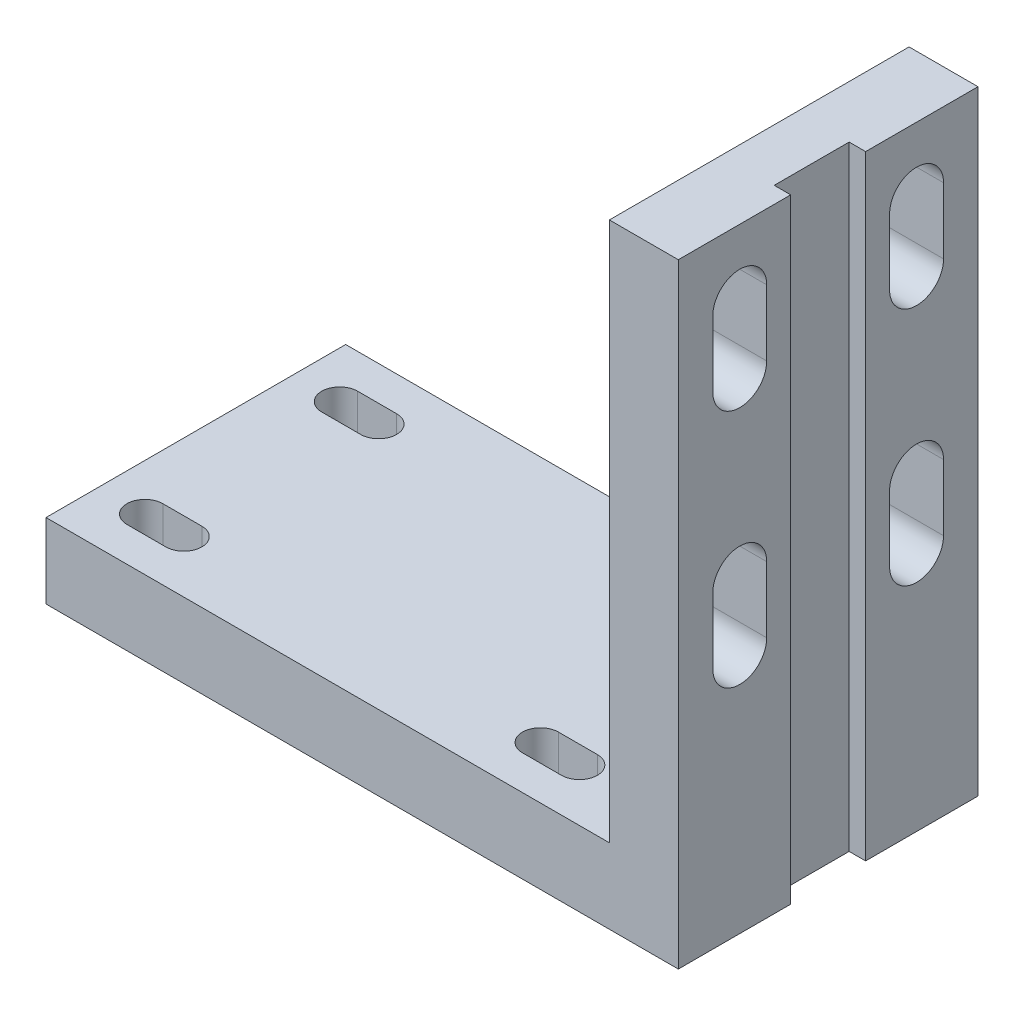
from build123d import *

# Parameters (mm, degrees)
SKETCH_1_W          = 23
SKETCH_1_H          = 205
EXTRUDE_1_DEPTH     = 100
SKETCH_3_W          = 188
SKETCH_3_H          = 25
EXTRUDE_3_DEPTH     = 100
CUT_EXTRUDE_1_REACH = 312.719
CUT_EXTRUDE_2_REACH = 312.719
SKETCH_6_W          = 25
SKETCH_6_H          = 205
CUT_EXTRUDE_3_DEPTH = 5.5


with BuildPart() as part:
    # 草图1 → 凸台-拉伸1 (new body)
    with BuildSketch(Plane.XY):
        with Locations((-11.5, -102.5)):
            Rectangle(SKETCH_1_W, SKETCH_1_H)
    extrude(amount=EXTRUDE_1_DEPTH)

    # 草图3 → 凸台-拉伸3 (add)
    with BuildSketch(Plane.XY.offset(100)):
        with Locations((-117, -192.5)):
            Rectangle(SKETCH_3_W, SKETCH_3_H)
    extrude(amount=-EXTRUDE_3_DEPTH)

    # 草图4 → 切除-拉伸1 (cut, up to next)
    with BuildSketch(Plane(origin=(0, 0, 0), x_dir=(0, 0, -1), z_dir=(1, 0, 0)), mode=Mode.PRIVATE) as cut_extrude_1_sk1:
        with BuildLine():
            Line((-70.5, -22), (-70.5, -44))
            ThreePointArc((-70.5, -44), (-79.5, -53), (-88.5, -44))
            Line((-88.5, -44), (-88.5, -22))
            ThreePointArc((-88.5, -22), (-79.5, -13), (-70.5, -22))
        make_face()
    cut_extrude_1_tool1 = extrude(cut_extrude_1_sk1.sketch, amount=-CUT_EXTRUDE_1_REACH, mode=Mode.PRIVATE) & part.part
    # 草图4 → 切除-拉伸1 (cut, up to next)
    with BuildSketch(Plane(origin=(0, 0, 0), x_dir=(0, 0, -1), z_dir=(1, 0, 0)), mode=Mode.PRIVATE) as cut_extrude_1_sk2:
        with BuildLine():
            Line((-11.5, -22), (-11.5, -44))
            ThreePointArc((-11.5, -44), (-20.5, -53), (-29.5, -44))
            Line((-29.5, -44), (-29.5, -22))
            ThreePointArc((-29.5, -22), (-20.5, -13), (-11.5, -22))
        make_face()
    cut_extrude_1_tool2 = extrude(cut_extrude_1_sk2.sketch, amount=-CUT_EXTRUDE_1_REACH, mode=Mode.PRIVATE) & part.part
    # 草图4 → 切除-拉伸1 (cut, up to next)
    with BuildSketch(Plane(origin=(0, 0, 0), x_dir=(0, 0, -1), z_dir=(1, 0, 0)), mode=Mode.PRIVATE) as cut_extrude_1_sk3:
        with BuildLine():
            Line((-70.5, -102), (-70.5, -124))
            ThreePointArc((-70.5, -124), (-79.5, -133), (-88.5, -124))
            Line((-88.5, -124), (-88.5, -102))
            ThreePointArc((-88.5, -102), (-79.5, -93), (-70.5, -102))
        make_face()
    cut_extrude_1_tool3 = extrude(cut_extrude_1_sk3.sketch, amount=-CUT_EXTRUDE_1_REACH, mode=Mode.PRIVATE) & part.part
    # 草图4 → 切除-拉伸1 (cut, up to next)
    with BuildSketch(Plane(origin=(0, 0, 0), x_dir=(0, 0, -1), z_dir=(1, 0, 0)), mode=Mode.PRIVATE) as cut_extrude_1_sk4:
        with BuildLine():
            Line((-11.5, -102), (-11.5, -124))
            ThreePointArc((-11.5, -124), (-20.5, -133), (-29.5, -124))
            Line((-29.5, -124), (-29.5, -102))
            ThreePointArc((-29.5, -102), (-20.5, -93), (-11.5, -102))
        make_face()
    cut_extrude_1_tool4 = extrude(cut_extrude_1_sk4.sketch, amount=-CUT_EXTRUDE_1_REACH, mode=Mode.PRIVATE) & part.part
    add(cut_extrude_1_tool1.solids().sort_by_distance((0, -33, 79.5))[0], mode=Mode.SUBTRACT)
    add(cut_extrude_1_tool2.solids().sort_by_distance((0, -33, 20.5))[0], mode=Mode.SUBTRACT)
    add(cut_extrude_1_tool3.solids().sort_by_distance((0, -113, 79.5))[0], mode=Mode.SUBTRACT)
    add(cut_extrude_1_tool4.solids().sort_by_distance((0, -113, 20.5))[0], mode=Mode.SUBTRACT)

    # 草图5 → 切除-拉伸2 (cut, up to next)
    with BuildSketch(Plane.XZ.offset(205), mode=Mode.PRIVATE) as cut_extrude_2_sk1:
        with BuildLine():
            Line((-195.5, 88.5), (-182.5, 88.5))
            ThreePointArc((-182.5, 88.5), (-176.5, 82.5), (-182.5, 76.5))
            Line((-182.5, 76.5), (-195.5, 76.5))
            ThreePointArc((-195.5, 76.5), (-201.5, 82.5), (-195.5, 88.5))
        make_face()
    cut_extrude_2_tool1 = extrude(cut_extrude_2_sk1.sketch, amount=-CUT_EXTRUDE_2_REACH, mode=Mode.PRIVATE) & part.part
    # 草图5 → 切除-拉伸2 (cut, up to next)
    with BuildSketch(Plane.XZ.offset(205), mode=Mode.PRIVATE) as cut_extrude_2_sk2:
        with BuildLine():
            Line((-63.5, 88.5), (-50.5, 88.5))
            ThreePointArc((-50.5, 88.5), (-44.5, 82.5), (-50.5, 76.5))
            Line((-50.5, 76.5), (-63.5, 76.5))
            ThreePointArc((-63.5, 76.5), (-69.5, 82.5), (-63.5, 88.5))
        make_face()
    cut_extrude_2_tool2 = extrude(cut_extrude_2_sk2.sketch, amount=-CUT_EXTRUDE_2_REACH, mode=Mode.PRIVATE) & part.part
    # 草图5 → 切除-拉伸2 (cut, up to next)
    with BuildSketch(Plane.XZ.offset(205), mode=Mode.PRIVATE) as cut_extrude_2_sk3:
        with BuildLine():
            Line((-195.5, 23.5), (-182.5, 23.5))
            ThreePointArc((-182.5, 23.5), (-176.5, 17.5), (-182.5, 11.5))
            Line((-182.5, 11.5), (-195.5, 11.5))
            ThreePointArc((-195.5, 11.5), (-201.5, 17.5), (-195.5, 23.5))
        make_face()
    cut_extrude_2_tool3 = extrude(cut_extrude_2_sk3.sketch, amount=-CUT_EXTRUDE_2_REACH, mode=Mode.PRIVATE) & part.part
    # 草图5 → 切除-拉伸2 (cut, up to next)
    with BuildSketch(Plane.XZ.offset(205), mode=Mode.PRIVATE) as cut_extrude_2_sk4:
        with BuildLine():
            Line((-63.5, 23.5), (-50.5, 23.5))
            ThreePointArc((-50.5, 23.5), (-44.5, 17.5), (-50.5, 11.5))
            Line((-50.5, 11.5), (-63.5, 11.5))
            ThreePointArc((-63.5, 11.5), (-69.5, 17.5), (-63.5, 23.5))
        make_face()
    cut_extrude_2_tool4 = extrude(cut_extrude_2_sk4.sketch, amount=-CUT_EXTRUDE_2_REACH, mode=Mode.PRIVATE) & part.part
    add(cut_extrude_2_tool1.solids().sort_by_distance((-189, -205, 82.5))[0], mode=Mode.SUBTRACT)
    add(cut_extrude_2_tool2.solids().sort_by_distance((-57, -205, 82.5))[0], mode=Mode.SUBTRACT)
    add(cut_extrude_2_tool3.solids().sort_by_distance((-189, -205, 17.5))[0], mode=Mode.SUBTRACT)
    add(cut_extrude_2_tool4.solids().sort_by_distance((-57, -205, 17.5))[0], mode=Mode.SUBTRACT)

    # 草图6 → 切除-拉伸3 (cut)
    with BuildSketch(Plane(origin=(0, 0, 0), x_dir=(0, 0, -1), z_dir=(1, 0, 0))):
        with Locations((-50, -102.5)):
            Rectangle(SKETCH_6_W, SKETCH_6_H)
    extrude(amount=-CUT_EXTRUDE_3_DEPTH, mode=Mode.SUBTRACT)


solid = part.part
